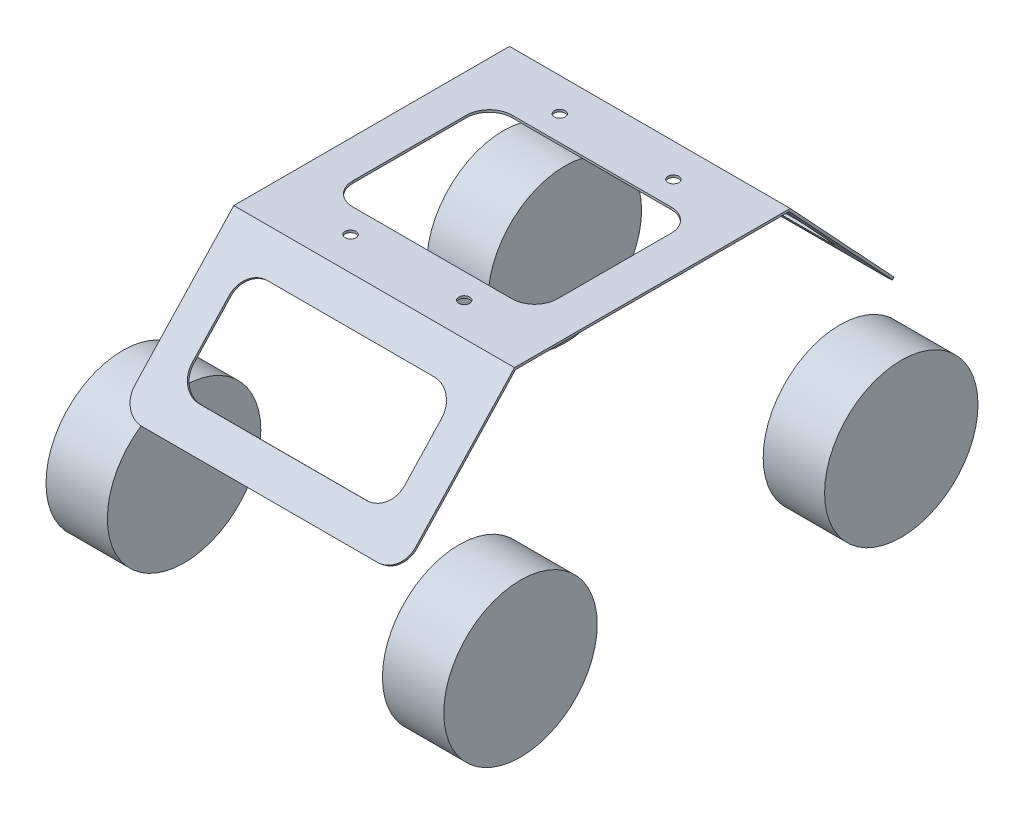
from build123d import *

# Parameters (mm, degrees)
ESBO_O1_W                  = 175
ESBO_O1_H                  = 235
RESSALTO_EXTRUS_O1_DEPTH   = 67.5
FILETE1_R                  = 33.75
CORTE_EXTRUS_O1_DEPTH      = 222.331199789
CORTE_EXTRUS_O2_DEPTH      = 162.303285769
CORTE_EXTRUS_O2_DEPTH_BACK = 162.303285769
ESBO_O3_W                  = 121
ESBO_O3_H                  = 67.5
ESBO_O4_W                  = 123.5
ESBO_O4_H                  = 222
RESSALTO_EXTRUS_O2_DEPTH   = 54
CORTE_EXTRUS_O3_DEPTH      = 227.843145147
ESBO_O7_R                  = 2.4
CORTE_EXTRUS_O4_DEPTH      = 192.933582262
CORTE_EXTRUS_O5_DEPTH      = 10


with BuildPart() as part:
    # Esboço1 → Ressalto-extrusão1 (new body)
    with BuildSketch(Plane(origin=(0, 0, 0), x_dir=(1, 0, 0), z_dir=(0, 1, 0))):
        Rectangle(ESBO_O1_W, ESBO_O1_H)
    extrude(amount=RESSALTO_EXTRUS_O1_DEPTH)

    # Filete1
    filete1_edges = [part.edges().sort_by_distance(p)[0] for p in [
        (0, 0, -117.5),
        (0, 67.5, -117.5),
        (0, 0, 117.5),
        (0, 67.5, 117.5),
    ]]
    fillet(filete1_edges, radius=FILETE1_R - 0.0001)  # a hair under: the kernel refuses the full size

    # Esboço2 → Corte-extrusão1 (cut, through all)
    with BuildSketch(Plane(origin=(87.5, 0, 0), x_dir=(0, 0, -1), z_dir=(1, 0, 0))):
        with BuildLine():
            Line((-83.75, 67.5), (83.75, 67.5))
            ThreePointArc((83.75, 67.5), (50, 33.75), (83.75, 0))
            Line((83.75, 0), (-83.75, 0))
            ThreePointArc((-83.75, 0), (-50, 33.75), (-83.75, 67.5))
        make_face()
    extrude(amount=-CORTE_EXTRUS_O1_DEPTH, mode=Mode.SUBTRACT)


with BuildPart() as corte_extrus_o1_piece_1:
    # of the separate pieces the step leaves, piece 1, a body of its own (corte_extrus_o1_pieces)
    add(part.part.solids().sort_by_distance((-87.5, 33.7499, -117.5))[0])


with BuildPart() as corte_extrus_o1_piece_2:
    # of the separate pieces the step leaves, piece 2, a body of its own (corte_extrus_o1_pieces)
    add(part.part.solids().sort_by_distance((-87.5, 33.7499, 117.5))[0])


with BuildPart() as corte_extrus_o2_tool:
    # Esboço3 → Corte-extrusão2 (new, two sides: drawn at the far end of the back side and taken through both)
    with BuildSketch(Plane.XY.offset(-CORTE_EXTRUS_O2_DEPTH_BACK)):
        with Locations((0, 33.75)):
            Rectangle(ESBO_O3_W, ESBO_O3_H)
    extrude(amount=CORTE_EXTRUS_O2_DEPTH + CORTE_EXTRUS_O2_DEPTH_BACK)


with BuildPart() as corte_extrus_o1_piece_1_1:
    add(corte_extrus_o1_piece_1.part)

    # Corte-extrusão2: cut by corte_extrus_o2_tool
    add(corte_extrus_o2_tool.part, mode=Mode.SUBTRACT)


with BuildPart() as corte_extrus_o1_piece_2_1:
    add(corte_extrus_o1_piece_2.part)

    # Corte-extrusão2: cut by corte_extrus_o2_tool
    add(corte_extrus_o2_tool.part, mode=Mode.SUBTRACT)


with BuildPart() as corte_extrus_o2_piece_1:
    # of the separate pieces the step leaves, piece 1, a body of its own (corte_extrus_o2_pieces)
    add(corte_extrus_o1_piece_1_1.part.solids().sort_by_distance((-87.5, 33.7499, -117.5))[0])


with BuildPart() as corte_extrus_o2_piece_2:
    # of the separate pieces the step leaves, piece 2, a body of its own (corte_extrus_o2_pieces)
    add(corte_extrus_o1_piece_1_1.part.solids().sort_by_distance((60.5, 33.7499, -117.5))[0])


with BuildPart() as corte_extrus_o2_piece_1_of_corte_extrus:
    # of the separate pieces the step leaves, piece 1, a body of its own (corte_extrus_o2_pieces_of_corte_extrus_o)
    add(corte_extrus_o1_piece_2_1.part.solids().sort_by_distance((87.5, 33.7499, 117.5))[0])


with BuildPart() as corte_extrus_o2_piece_2_of_corte_extrus:
    # of the separate pieces the step leaves, piece 2, a body of its own (corte_extrus_o2_pieces_of_corte_extrus_o)
    add(corte_extrus_o1_piece_2_1.part.solids().sort_by_distance((-87.5, 33.7499, 117.5))[0])


with BuildPart() as body_5:
    # Esboço4 → Ressalto-extrusão2 (new body)
    with BuildSketch(Plane(origin=(0, 70, 0), x_dir=(1, 0, 0), z_dir=(0, 1, 0))):
        Rectangle(ESBO_O4_W, ESBO_O4_H)
    extrude(amount=RESSALTO_EXTRUS_O2_DEPTH)

    # Esboço6 → Corte-extrusão3 (cut, through all)
    with BuildSketch(Plane(origin=(61.75, 0, 0), x_dir=(0, 0, -1), z_dir=(1, 0, 0))):
        Polygon((-111, 70), (-111, 124), (-60.644185349, 124), align=None)
        Polygon((111, 124), (111, 70), (60.644185349, 124), align=None)
        Polygon((-109.632672539, 70), (-60.209372974, 123), (60.209372974, 123), (109.632672539, 70), align=None)
    extrude(amount=-CORTE_EXTRUS_O3_DEPTH, mode=Mode.SUBTRACT)

    # Esboço7 → Corte-extrusão4 (cut, through all)
    with BuildSketch(Plane(origin=(0, 124, 0), x_dir=(1, 0, 0), z_dir=(0, 1, 0))):
        with Locations(Location((-25, -46, 0), (0, 0, 270))):
            Circle(ESBO_O7_R)
        with Locations(Location((25, -46, 0), (0, 0, 270))):
            Circle(ESBO_O7_R)
        with Locations(Location((-25, 46, 0), (0, 0, 270))):
            Circle(ESBO_O7_R)
        with Locations(Location((25, 46, 0), (0, 0, 270))):
            Circle(ESBO_O7_R)
        with BuildLine():
            Line((-35, 35), (35, 35))
            ThreePointArc((35, 35), (42.071067812, 32.071067812), (45, 25))
            Line((45, 25), (45, -25))
            ThreePointArc((45, -25), (42.071067812, -32.071067812), (35, -35))
            Line((35, -35), (-35, -35))
            ThreePointArc((-35, -35), (-42.071067812, -32.071067812), (-45, -25))
            Line((-45, -25), (-45, 25))
            ThreePointArc((-45, 25), (-42.071067812, 32.071067812), (-35, 35))
        make_face()
    extrude(amount=-CORTE_EXTRUS_O4_DEPTH, mode=Mode.SUBTRACT)

    # Esboço8 → Corte-extrusão5 (cut)
    with BuildSketch(Plane(origin=(0, 87.923328208, -94.286226052), x_dir=(-1, 0, 0), z_dir=(0, 0.6819983600624947, -0.731353701619174))):
        with BuildLine():
            Line((-36.75, 34.328624046), (36.75, 34.328624046))
            ThreePointArc((36.75, 34.328624046), (43.821067812, 31.399691858), (46.75, 24.328624046))
            Line((46.75, 24.328624046), (46.75, 0.492941146))
            ThreePointArc((46.75, 0.492941146), (43.821067812, -6.578126665), (36.75, -9.507058854))
            Line((36.75, -9.507058854), (-36.75, -9.507058854))
            ThreePointArc((-36.75, -9.507058854), (-43.821067812, -6.578126665), (-46.75, 0.492941146))
            Line((-46.75, 0.492941146), (-46.75, 24.328624046))
            ThreePointArc((-46.75, 24.328624046), (-43.821067812, 31.399691858), (-36.75, 34.328624046))
        make_face()
        with BuildLine():
            Line((-61.75, -24.507058854), (-51.75, -24.507058854))
            ThreePointArc((-51.75, -24.507058854), (-58.821067812, -21.578126665), (-61.75, -14.507058854))
            Line((-61.75, -14.507058854), (-61.75, -24.507058854))
        make_face()
        with BuildLine():
            ThreePointArc((61.75, -14.507058854), (58.821067812, -21.578126665), (51.75, -24.507058854))
            Line((51.75, -24.507058854), (61.75, -24.507058854))
            Line((61.75, -24.507058854), (61.75, -14.507058854))
        make_face()
    corte_extrus_o5 = extrude(amount=-CORTE_EXTRUS_O5_DEPTH, mode=Mode.SUBTRACT)

    # Espelhar1: Corte-extrusão5 across plane
    add(corte_extrus_o5.mirror(Plane.XY), mode=Mode.SUBTRACT)


solid = Compound([corte_extrus_o2_piece_1.part, corte_extrus_o2_piece_2.part, corte_extrus_o2_piece_1_of_corte_extrus.part, corte_extrus_o2_piece_2_of_corte_extrus.part, body_5.part])
